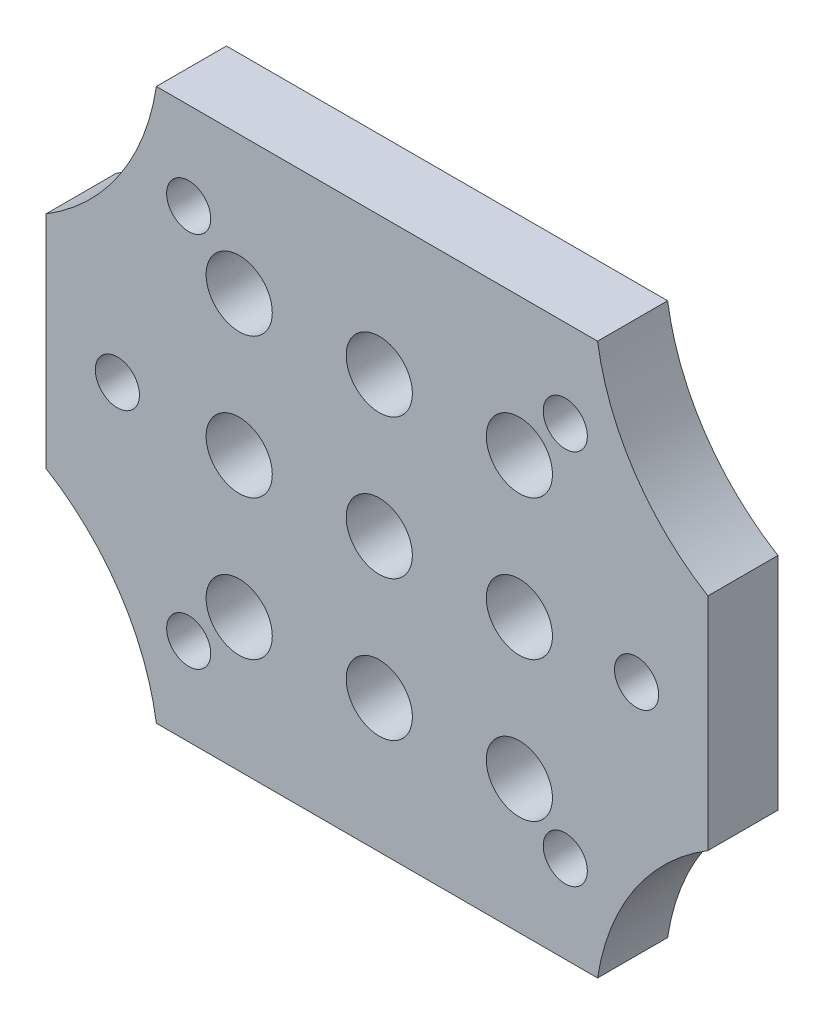
from build123d import *

# Parameters (mm, degrees)
SKETCH1_W                 = 60
SKETCH1_H                 = 50
BOSS_EXTRUDE1_DEPTH       = 6.35
SKETCH2_R                 = 2
CUT_EXTRUDE1_DEPTH        = 6.35
SKETCH3_R                 = 3
CUT_EXTRUDE2_DEPTH        = 40.564156758
LPATTERN1_COUNT           = 3
LPATTERN1_PITCH           = 12.7
LPATTERN2_COPY_1_SKETCH_R = 3
LPATTERN2_COPY_1_DEPTH    = 40.564156758
LPATTERN2_COPY_2_SKETCH_R = 3
LPATTERN2_COPY_2_DEPTH    = 40.564156758
LPATTERN2_COPY_3_SKETCH_R = 3
LPATTERN2_COPY_3_DEPTH    = 40.564156758
LPATTERN2_COPY_4_SKETCH_R = 3
LPATTERN2_COPY_4_DEPTH    = 40.564156758
LPATTERN2_COPY_5_SKETCH_R = 3
LPATTERN2_COPY_5_DEPTH    = 40.564156758
LPATTERN2_COPY_6_SKETCH_R = 3
LPATTERN2_COPY_6_DEPTH    = 40.564156758


with BuildPart() as part:
    # Sketch1 → Boss-Extrude1 (new body)
    with BuildSketch(Plane.XY):
        Rectangle(SKETCH1_W, SKETCH1_H)
    extrude(amount=BOSS_EXTRUDE1_DEPTH)

    # Sketch2 → Cut-Extrude1 (cut)
    with BuildSketch(Plane.XY.offset(6.35)):
        with Locations((-17.07106781, 17.07106781)):
            Circle(SKETCH2_R)
        with Locations((17.07106781, 17.07106781)):
            Circle(SKETCH2_R)
        with Locations((-17.07106781, -17.07106781)):
            Circle(SKETCH2_R)
        with Locations((17.07106781, -17.07106781)):
            Circle(SKETCH2_R)
        with Locations((-23.535533905, 0)):
            Circle(SKETCH2_R)
        with Locations((23.535533905, 0)):
            Circle(SKETCH2_R)
        with BuildLine():
            Line((-30, 25), (-30, 10))
            ThreePointArc((-30, 10), (-23.335411727, 16.390274485), (-20, 25))
            Line((-20, 25), (-30, 25))
        make_face()
        with BuildLine():
            ThreePointArc((-20, -25), (-23.335411727, -16.390274485), (-30, -10))
            Line((-30, -10), (-30, -25))
            Line((-30, -25), (-20, -25))
        make_face()
        with BuildLine():
            Line((30, 25), (20, 25))
            ThreePointArc((20, 25), (23.335411727, 16.390274485), (30, 10))
            Line((30, 10), (30, 25))
        make_face()
        with BuildLine():
            ThreePointArc((30, -10), (23.335411727, -16.390274485), (20, -25))
            Line((20, -25), (30, -25))
            Line((30, -25), (30, -10))
        make_face()
    extrude(amount=-CUT_EXTRUDE1_DEPTH, mode=Mode.SUBTRACT)

    # Sketch3 → Cut-Extrude2 (cut, through all)
    with BuildSketch(Plane.XY.offset(6.35)):
        with Locations((-12.490915526, 12.490915526)):
            Circle(SKETCH3_R)
    cut_extrude2 = extrude(amount=-CUT_EXTRUDE2_DEPTH, mode=Mode.SUBTRACT)

    # LPattern1: Cut-Extrude2 ×3
    with Locations(*[(i * LPATTERN1_PITCH, 0, 0) for i in range(1, LPATTERN1_COUNT)]):
        add(cut_extrude2, mode=Mode.SUBTRACT)

    # LPattern2 copy 1 sketch → LPattern2 copy 1 (cut, through all)
    with BuildSketch(Plane(origin=(12.7, -12.7, 6.35), x_dir=(1, 0, 0), z_dir=(0, 0, 1))):
        with Locations((-12.490915526, 12.490915526)):
            Circle(LPATTERN2_COPY_1_SKETCH_R)
    extrude(amount=-LPATTERN2_COPY_1_DEPTH, mode=Mode.SUBTRACT)

    # LPattern2 copy 2 sketch → LPattern2 copy 2 (cut, through all)
    with BuildSketch(Plane(origin=(12.7, -25.4, 6.35), x_dir=(1, 0, 0), z_dir=(0, 0, 1))):
        with Locations((-12.490915526, 12.490915526)):
            Circle(LPATTERN2_COPY_2_SKETCH_R)
    extrude(amount=-LPATTERN2_COPY_2_DEPTH, mode=Mode.SUBTRACT)

    # LPattern2 copy 3 sketch → LPattern2 copy 3 (cut, through all)
    with BuildSketch(Plane(origin=(25.4, -12.7, 6.35), x_dir=(1, 0, 0), z_dir=(0, 0, 1))):
        with Locations((-12.490915526, 12.490915526)):
            Circle(LPATTERN2_COPY_3_SKETCH_R)
    extrude(amount=-LPATTERN2_COPY_3_DEPTH, mode=Mode.SUBTRACT)

    # LPattern2 copy 4 sketch → LPattern2 copy 4 (cut, through all)
    with BuildSketch(Plane(origin=(25.4, -25.4, 6.35), x_dir=(1, 0, 0), z_dir=(0, 0, 1))):
        with Locations((-12.490915526, 12.490915526)):
            Circle(LPATTERN2_COPY_4_SKETCH_R)
    extrude(amount=-LPATTERN2_COPY_4_DEPTH, mode=Mode.SUBTRACT)

    # LPattern2 copy 5 sketch → LPattern2 copy 5 (cut, through all)
    with BuildSketch(Plane(origin=(0, -12.7, 6.35), x_dir=(1, 0, 0), z_dir=(0, 0, 1))):
        with Locations((-12.490915526, 12.490915526)):
            Circle(LPATTERN2_COPY_5_SKETCH_R)
    extrude(amount=-LPATTERN2_COPY_5_DEPTH, mode=Mode.SUBTRACT)

    # LPattern2 copy 6 sketch → LPattern2 copy 6 (cut, through all)
    with BuildSketch(Plane(origin=(0, -25.4, 6.35), x_dir=(1, 0, 0), z_dir=(0, 0, 1))):
        with Locations((-12.490915526, 12.490915526)):
            Circle(LPATTERN2_COPY_6_SKETCH_R)
    extrude(amount=-LPATTERN2_COPY_6_DEPTH, mode=Mode.SUBTRACT)


solid = part.part
